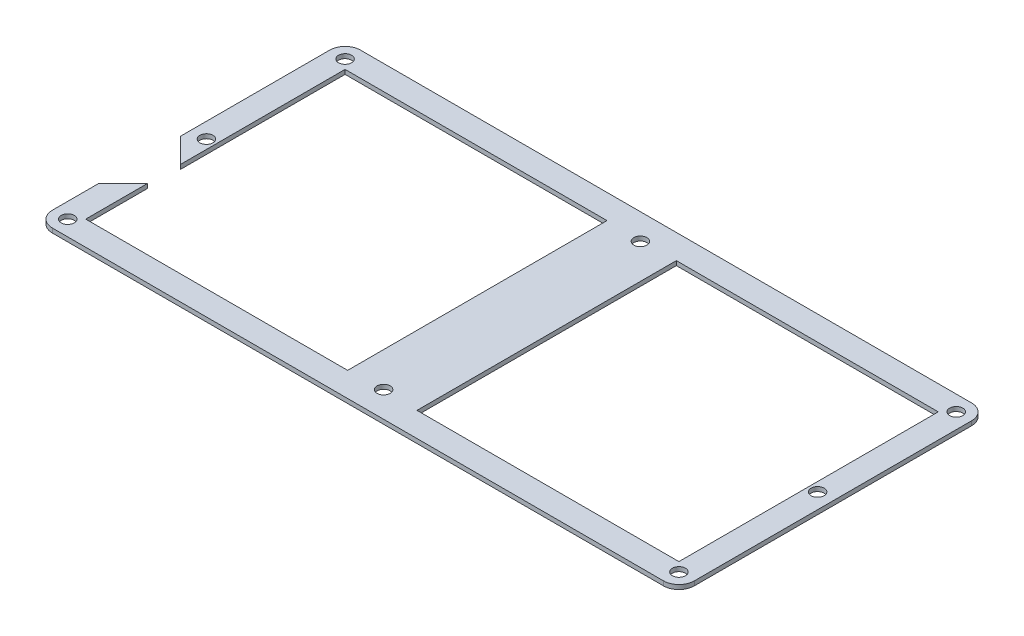
from build123d import *

# Parameters (mm, degrees)
SKETCH_3_R      = 2.55
EXTRUDE_1_DEPTH = 1.7


with BuildPart() as part:
    # 草图3 → 凸台-拉伸1 (new body)
    with BuildSketch(Plane(origin=(0, 0, 0), x_dir=(1, 0, 0), z_dir=(0, 1, 0))):
        with BuildLine():
            Line((9.345866043, 60.021458283), (9.345866043, 118.021458283))
            ThreePointArc((9.345866043, 118.021458283), (11.103225356, 122.26409897), (15.345866043, 124.021458283))
            Line((15.345866043, 124.021458283), (253.345866043, 124.021458283))
            ThreePointArc((253.345866043, 124.021458283), (257.58850673, 122.26409897), (259.345866043, 118.021458283))
            Line((259.345866043, 118.021458283), (259.345866043, 10.021458283))
            ThreePointArc((259.345866043, 10.021458283), (257.58850673, 5.778817596), (253.345866043, 4.021458283))
            Line((253.345866043, 4.021458283), (15.345866043, 4.021458283))
            ThreePointArc((15.345866043, 4.021458283), (11.103225356, 5.778817596), (9.345866043, 10.021458283))
            Line((9.345866043, 10.021458283), (9.345866043, 28.021458283))
            Line((9.345866043, 28.021458283), (18.845866043, 37.521458283))
            Line((18.845866043, 37.521458283), (18.845866043, 13.521458283))
            Line((18.845866043, 13.521458283), (119.845866043, 13.521458283))
            Line((119.845866043, 13.521458283), (120.845866043, 13.521458283))
            Line((120.845866043, 13.521458283), (120.845866043, 114.521458283))
            Line((120.845866043, 114.521458283), (119.845866043, 114.521458283))
            Line((119.845866043, 114.521458283), (18.845866043, 114.521458283))
            Line((18.845866043, 114.521458283), (18.845866043, 50.521458283))
            Line((18.845866043, 50.521458283), (9.345866043, 60.021458283))
        make_face()
        with Locations((15.345866043, 118.021458283)):
            Circle(SKETCH_3_R, mode=Mode.SUBTRACT)
        with Locations((253.345866043, 118.021458283)):
            Circle(SKETCH_3_R, mode=Mode.SUBTRACT)
        with Locations((134.345866043, 114.021458283)):
            Circle(SKETCH_3_R, mode=Mode.SUBTRACT)
        with Locations((15.345866043, 10.021458283)):
            Circle(SKETCH_3_R, mode=Mode.SUBTRACT)
        with Locations((253.345866043, 10.021458283)):
            Circle(SKETCH_3_R, mode=Mode.SUBTRACT)
        with Locations((134.345866043, 14.021458283)):
            Circle(SKETCH_3_R, mode=Mode.SUBTRACT)
        with Locations((253.345866043, 64.021458283)):
            Circle(SKETCH_3_R, mode=Mode.SUBTRACT)
        with Locations((15.345866043, 64.021458283)):
            Circle(SKETCH_3_R, mode=Mode.SUBTRACT)
        Polygon((148.845866043, 114.521458283), (249.845866043, 114.521458283), (249.845866043, 13.521458283), (148.845866043, 13.521458283), (147.845866043, 13.521458283), (147.845866043, 114.521458283), align=None, mode=Mode.SUBTRACT)
    extrude(amount=EXTRUDE_1_DEPTH)


solid = part.part
